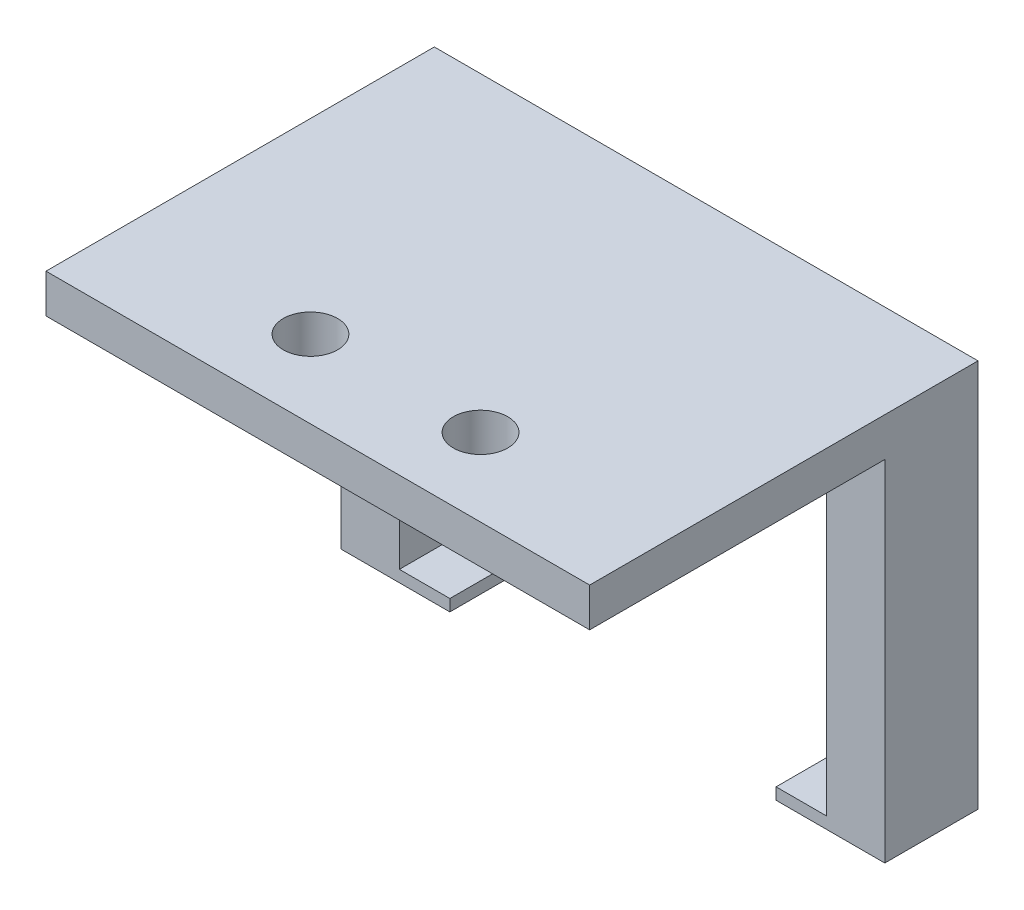
from build123d import *

# Parameters (mm, degrees)
SKETCH3_W           = 35.56
SKETCH3_H           = 25.4
SKETCH3_R           = 1.778
BOSS_EXTRUDE3_DEPTH = 2.54
SKETCH4_W           = 3.81
SKETCH4_H           = 11.176
BOSS_EXTRUDE4_DEPTH = 22.86
SKETCH5_W           = 11.176
SKETCH5_H           = 0.762
BOSS_EXTRUDE5_DEPTH = 3.302
SKETCH6_W           = 11.176
SKETCH6_H           = 0.762
BOSS_EXTRUDE6_DEPTH = 3.302
SKETCH7_W           = 35.56
SKETCH7_H           = 22.86
CUT_EXTRUDE1_DEPTH  = 5.08


with BuildPart() as part:
    # Sketch3 → Boss-Extrude3 (new body)
    with BuildSketch(Plane(origin=(0, 0, 0), x_dir=(1, 0, 0), z_dir=(0, 1, 0))):
        with Locations((6.262748092, -0.232671756)):
            Rectangle(SKETCH3_W, SKETCH3_H)
        with Locations((0.700148092, -7.852671756)):
            Circle(SKETCH3_R, mode=Mode.SUBTRACT)
        with Locations((11.825348092, -7.852671756)):
            Circle(SKETCH3_R, mode=Mode.SUBTRACT)
    extrude(amount=BOSS_EXTRUDE3_DEPTH)

    # Sketch4 → Boss-Extrude4 (add)
    with BuildSketch(Plane.XZ):
        with Locations((-9.612251908, -6.879328244)):
            Rectangle(SKETCH4_W, SKETCH4_H)
        with Locations((22.137748092, -6.879328244)):
            Rectangle(SKETCH4_W, SKETCH4_H)
    extrude(amount=BOSS_EXTRUDE4_DEPTH)

    # Sketch5 → Boss-Extrude5 (add)
    with BuildSketch(Plane(origin=(-7.707251908, 0, 0), x_dir=(0, 0, -1), z_dir=(1, 0, 0))):
        with Locations((6.879328244, -22.479)):
            Rectangle(SKETCH5_W, SKETCH5_H)
    extrude(amount=BOSS_EXTRUDE5_DEPTH)

    # Sketch6 → Boss-Extrude6 (add)
    with BuildSketch(Plane.ZY.offset(-20.232748092)):
        with Locations((-6.879328244, -22.479)):
            Rectangle(SKETCH6_W, SKETCH6_H)
    extrude(amount=BOSS_EXTRUDE6_DEPTH)

    # Sketch7 → Cut-Extrude1 (cut)
    with BuildSketch(Plane.XY.offset(-1.291328244)):
        with Locations((6.262748092, -11.43)):
            Rectangle(SKETCH7_W, SKETCH7_H)
    extrude(amount=-CUT_EXTRUDE1_DEPTH, mode=Mode.SUBTRACT)


solid = part.part
